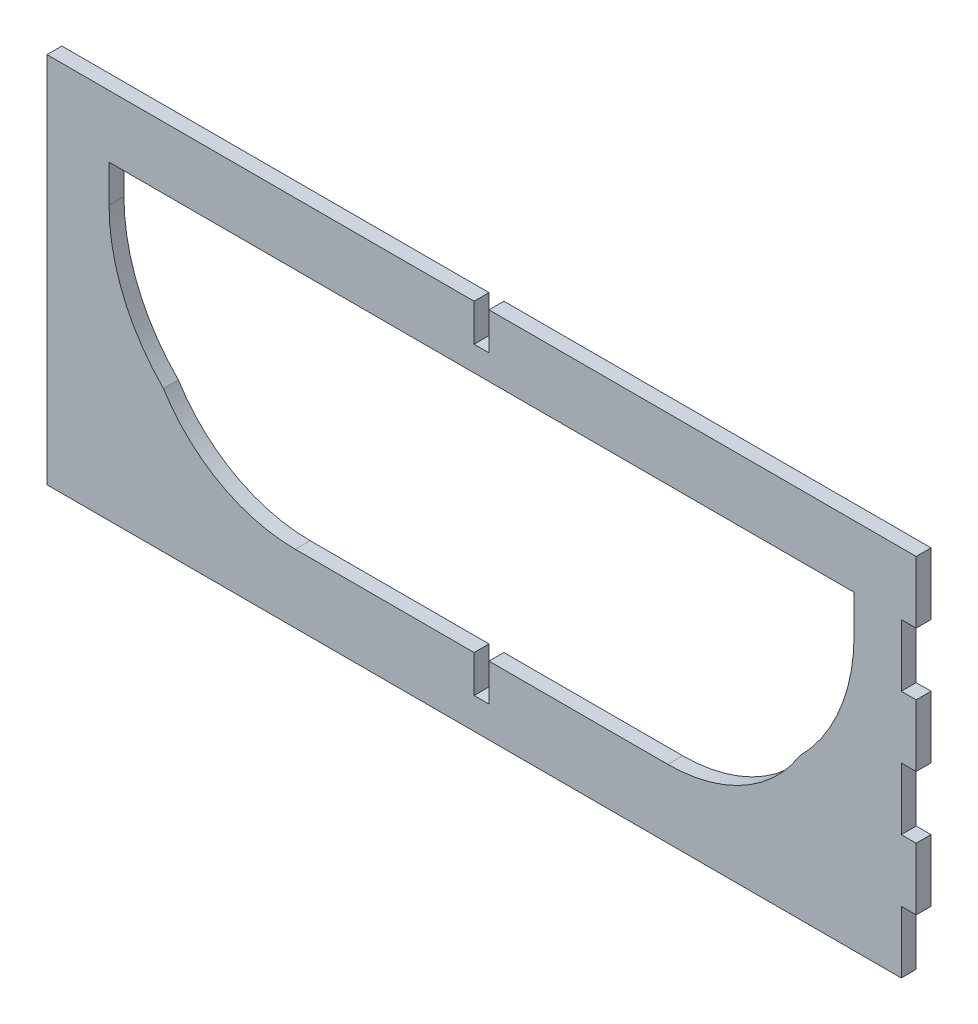
from build123d import *

# Parameters (mm, degrees)
SKETCH1_W           = 200
SKETCH1_H           = 150
BOSS_EXTRUDE1_DEPTH = 6
SKETCH3_W           = 100
SKETCH3_H           = 97.5
CUT_EXTRUDE1_DEPTH  = 6
BOSS_EXTRUDE3_DEPTH = 6
SKETCH5_W           = 6
SKETCH5_H           = 15
CUT_EXTRUDE2_DEPTH  = 6
SKETCH6_W           = 6
SKETCH6_H           = 25
CUT_EXTRUDE3_DEPTH  = 6
LPATTERN1_COUNT     = 3
LPATTERN1_PITCH     = 50


with BuildPart() as part:
    # Sketch1 → Boss-Extrude1 (new body)
    with BuildSketch(Plane.XY):
        with Locations((-100, 75)):
            Rectangle(SKETCH1_W, SKETCH1_H)
        with BuildLine():
            Line((-175, 110), (-175, 125))
            Line((-175, 125), (-25, 125))
            Line((-25, 125), (-25, 110))
            ThreePointArc((-25, 110), (-30.691670032, 81.340701386), (-46.902810588, 57.03125))
            ThreePointArc((-46.902810588, 57.03125), (-100, 27.5), (-153.097189412, 57.03125))
            ThreePointArc((-153.097189412, 57.03125), (-169.308329968, 81.340701386), (-175, 110))
        make_face(mode=Mode.SUBTRACT)
    extrude(amount=BOSS_EXTRUDE1_DEPTH)

    # Sketch3 → Cut-Extrude1 (cut)
    with BuildSketch(Plane.XY.offset(6)):
        with Locations((-150, 76.25)):
            Rectangle(SKETCH3_W, SKETCH3_H)
    extrude(amount=-CUT_EXTRUDE1_DEPTH, mode=Mode.SUBTRACT)

    # Sketch4 → Boss-Extrude3 (add)
    with BuildSketch(Plane.XY.offset(6)):
        with BuildLine():
            Line((-200, 27.5), (-250, 27.5))
            ThreePointArc((-250, 27.5), (-280.378472024, 35.379505335), (-303.097189412, 57.03125))
            ThreePointArc((-303.097189412, 57.03125), (-319.308329968, 81.340701386), (-325, 110))
            Line((-325, 110), (-325, 125))
            Line((-325, 125), (-200, 125))
            Line((-200, 125), (-200, 150))
            Line((-200, 150), (-350, 150))
            Line((-350, 150), (-350, 0))
            Line((-350, 0), (-200, 0))
            Line((-200, 0), (-200, 27.5))
        make_face()
    extrude(amount=-BOSS_EXTRUDE3_DEPTH)

    # Sketch5 → Cut-Extrude2 (cut)
    with BuildSketch(Plane.XY.offset(6)):
        with Locations((-175, 142.5)):
            Rectangle(SKETCH5_W, SKETCH5_H)
        with Locations((-175, 20)):
            Rectangle(SKETCH5_W, SKETCH5_H)
    extrude(amount=-CUT_EXTRUDE2_DEPTH, mode=Mode.SUBTRACT)

    # Sketch6 → Cut-Extrude3 (cut)
    with BuildSketch(Plane.XY.offset(6)):
        with Locations((-3, 112.5)):
            Rectangle(SKETCH6_W, SKETCH6_H)
    cut_extrude3 = extrude(amount=-CUT_EXTRUDE3_DEPTH, mode=Mode.SUBTRACT)

    # LPattern1: Cut-Extrude3 ×3
    with Locations(*[(0, -i * LPATTERN1_PITCH, 0) for i in range(1, LPATTERN1_COUNT)]):
        add(cut_extrude3, mode=Mode.SUBTRACT)


solid = part.part
